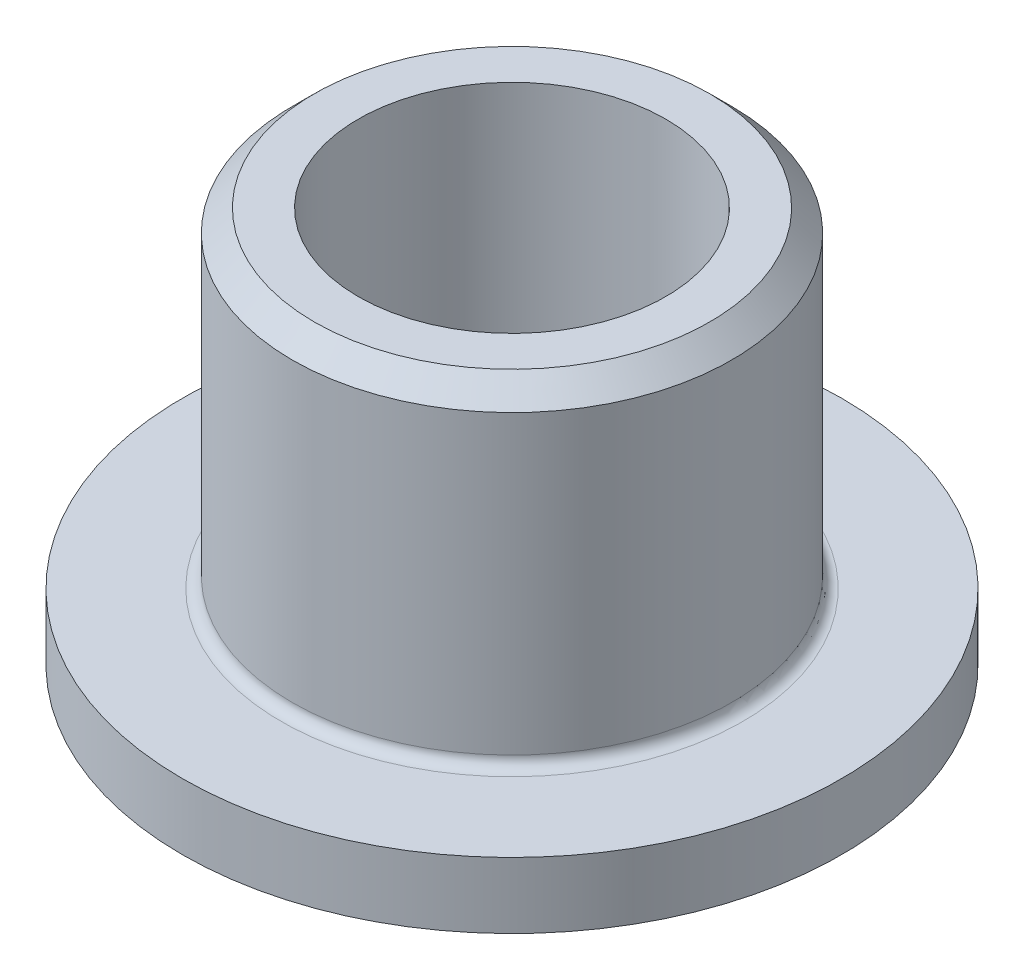
from build123d import *

# Parameters (mm, degrees)
SKETCH1_R           = 5
SKETCH1_R_2         = 3.5
BOSS_EXTRUDE1_DEPTH = 7.5
BOSS_EXTRUDE2_START = 1.5
SKETCH2_R           = 7.5
SKETCH2_R_2         = 3.5
BOSS_EXTRUDE2_DEPTH = 1.5
CHAMFER1_SIZE       = 0.5
FILLET1_R           = 0.25


with BuildPart() as part:
    # Sketch1 → Boss-Extrude1 (new body)
    with BuildSketch(Plane(origin=(0, 0, 0), x_dir=(1, 0, 0), z_dir=(0, 1, 0))):
        Circle(SKETCH1_R)
        Circle(SKETCH1_R_2, mode=Mode.SUBTRACT)
    extrude(amount=BOSS_EXTRUDE1_DEPTH)

    # Sketch2 → Boss-Extrude2 (add)
    with BuildSketch(Plane.XZ.offset(BOSS_EXTRUDE2_START)):
        Circle(SKETCH2_R)
        Circle(SKETCH2_R_2, mode=Mode.SUBTRACT)
    extrude(amount=-BOSS_EXTRUDE2_DEPTH)

    # Chamfer1
    chamfer1_edges = [part.edges().sort_by_distance(p)[0] for p in [
        (-5, 7.5, 0),
    ]]
    chamfer(chamfer1_edges, length=CHAMFER1_SIZE)

    # Fillet1
    fillet1_edges = [part.edges().sort_by_distance(p)[0] for p in [
        (-5, 0, 0),
    ]]
    fillet(fillet1_edges, radius=FILLET1_R)


solid = part.part
